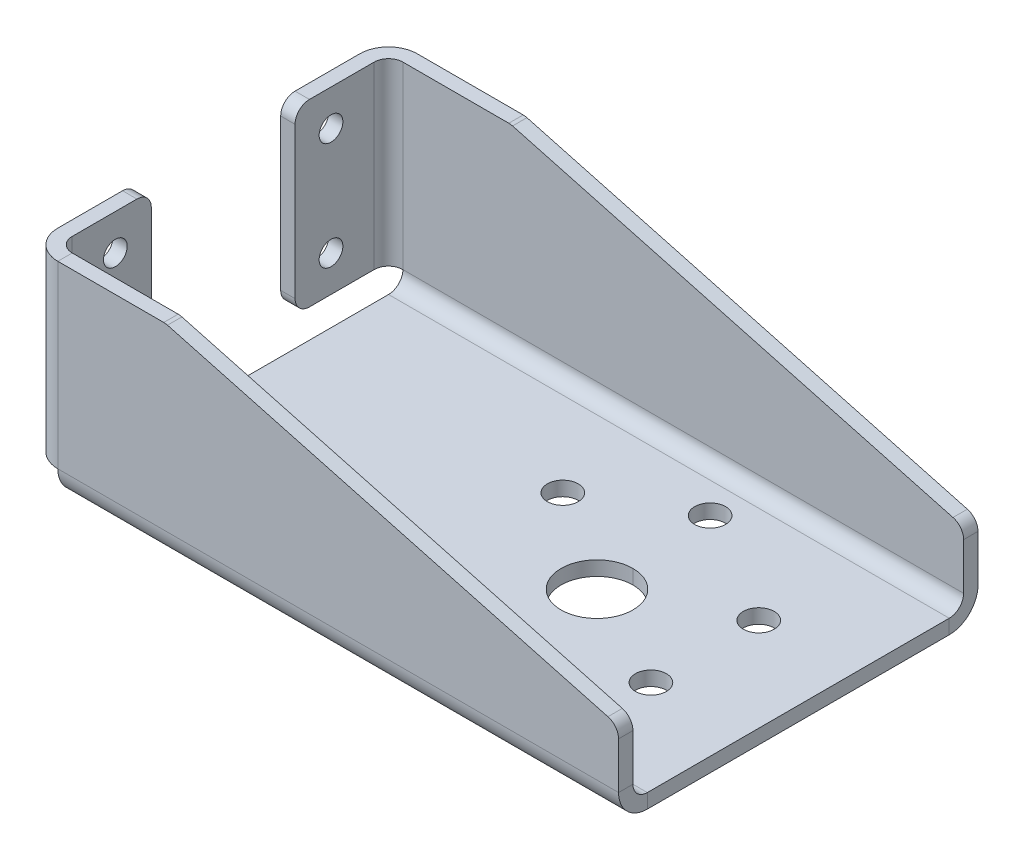
from build123d import *

# Parameters (mm, degrees)
EXTRUDE_1_DEPTH          = 78
EXTRUDE_START            = -4
EXTRUDE_1_2_OUTLINE_R    = 2.1
EXTRUDE_1_2_DEPTH        = 4
EXTRUDE_START_2          = -1
EXTRUDE_1_3_OUTLINE_R    = 5
EXTRUDE_1_3_OUTLINE_R_2  = 2.5
EXTRUDE_1_3_DEPTH        = 30
EXTRUDE_START_3          = -25
EXTRUDE_1_4_DEPTH        = 2
EXTRUDE_2_DEPTH          = 2
CUT_EXTRUDE_1_DEPTH      = 98.082439195
FILLET_1_R               = 2
EXTRUDE_START_4          = -2
SKETCH_4_R               = 2.1
SKETCH_4_R_2             = 1
EXTRUDE_3_DEPTH          = 2
HOLE_WIZARD_M4_1_D       = 3.3
HOLE_WIZARD_M4_1_DEPTH   = 11.5
HOLE_WIZARD_M4_1_TIP     = 0.991420021
SKETCH_8_W               = 20
SKETCH_8_H               = 25
CUT_EXTRUDE_2_DEPTH      = 91.498618774
FILLET_2_R               = 2
SKETCH_9_R               = 2.5
SKETCH_9_R_2             = 2.15
EXTRUDE_4_DEPTH          = 2
PATTERN_CIRCULAR_2_COUNT = 3


with BuildPart() as part:
    # ﾎﾞｽ - 押し出し1: read off the stored shape, not the designer's step
    # ﾎﾞｽ - 押し出し1 outline → ﾎﾞｽ - 押し出し1 (new body)
    with BuildSketch(Plane.YZ):
        with BuildLine():
            Line((29, 25), (4, 25))
            ThreePointArc((4, 25), (1.171572875, 23.828427125), (0, 21))
            Line((0, 21), (0, -21))
            ThreePointArc((0, -21), (1.171572875, -23.828427125), (4, -25))
            Line((4, -25), (29, -25))
            Line((29, -25), (29, -23))
            Line((29, -23), (4, -23))
            ThreePointArc((4, -23), (2.585786438, -22.414213562), (2, -21))
            Line((2, -21), (2, 21))
            ThreePointArc((2, 21), (2.585786438, 22.414213562), (4, 23))
            Line((4, 23), (29, 23))
            Line((29, 23), (29, 25))
        make_face()
    extrude(amount=EXTRUDE_1_DEPTH)

    # Extrude 1 2 outline → Extrude 1 2 (add)
    # profile 1 of 2: a face of its own
    with BuildSketch(Plane.YZ.offset(EXTRUDE_START)):
        with BuildLine():
            ThreePointArc((4, 8), (4.228361402, 6.851949703), (4.878679656, 5.878679656))
            ThreePointArc((4.878679656, 5.878679656), (5.851949703, 5.228361402), (7, 5))
            Line((7, 5), (26, 5))
            ThreePointArc((26, 5), (27.148050297, 5.228361402), (28.121320344, 5.878679656))
            ThreePointArc((28.121320344, 5.878679656), (28.771638598, 6.851949703), (29, 8))
            Line((29, 8), (29, 25))
            Line((29, 25), (4, 25))
            Line((4, 25), (4, 8))
        make_face()
        with Locations((9, 15)):
            Circle(EXTRUDE_1_2_OUTLINE_R, mode=Mode.SUBTRACT)
        with Locations((24, 15)):
            Circle(EXTRUDE_1_2_OUTLINE_R, mode=Mode.SUBTRACT)
    # profile 2 of 2: a face of its own
    with BuildSketch(Plane.YZ.offset(EXTRUDE_START)):
        with BuildLine():
            Line((4, -25), (29, -25))
            Line((29, -25), (29, -8))
            ThreePointArc((29, -8), (28.771638598, -6.851949703), (28.121320344, -5.878679656))
            ThreePointArc((28.121320344, -5.878679656), (27.148050297, -5.228361402), (26, -5))
            Line((26, -5), (7, -5))
            ThreePointArc((7, -5), (5.851949703, -5.228361402), (4.878679656, -5.878679656))
            ThreePointArc((4.878679656, -5.878679656), (4.228361402, -6.851949703), (4, -8))
            Line((4, -8), (4, -25))
        make_face()
        with Locations((9, -15)):
            Circle(EXTRUDE_1_2_OUTLINE_R, mode=Mode.SUBTRACT)
        with Locations((24, -15)):
            Circle(EXTRUDE_1_2_OUTLINE_R, mode=Mode.SUBTRACT)
    extrude(amount=EXTRUDE_1_2_DEPTH)

    # Extrude 1 3 outline → Extrude 1 3 (cut)
    with BuildSketch(Plane(origin=(0, 0, 0), x_dir=(1, 0, 0), z_dir=(0, 1, 0)).offset(EXTRUDE_START_2)):
        with Locations((50, 0)):
            Circle(EXTRUDE_1_3_OUTLINE_R)
        with BuildLine():
            Line((0, -5), (-2, -5))
            Line((-2, -5), (-2, -21))
            ThreePointArc((-2, -21), (-1.414213562, -22.414213562), (0, -23))
            Line((0, -23), (0, -5))
        make_face()
        with BuildLine():
            ThreePointArc((0, -25), (-2.828427125, -23.828427125), (-4, -21))
            Line((-4, -21), (-4, -25))
            Line((-4, -25), (0, -25))
        make_face()
        with BuildLine():
            Line((0, 5), (0, 23))
            ThreePointArc((0, 23), (-1.414213562, 22.414213562), (-2, 21))
            Line((-2, 21), (-2, 5))
            Line((-2, 5), (0, 5))
        make_face()
        with BuildLine():
            ThreePointArc((-4, 21), (-2.828427125, 23.828427125), (0, 25))
            Line((0, 25), (-4, 25))
            Line((-4, 25), (-4, 21))
        make_face()
        with Locations((36.004809472, 9.240381057)):
            Circle(EXTRUDE_1_3_OUTLINE_R_2)
        with Locations((48.995190528, -16.740381057)):
            Circle(EXTRUDE_1_3_OUTLINE_R_2)
        with Locations((65, -7.5)):
            Circle(EXTRUDE_1_3_OUTLINE_R_2)
        with Locations((65, 7.5)):
            Circle(EXTRUDE_1_3_OUTLINE_R_2)
        with Locations((36.004809472, -9.240381057)):
            Circle(EXTRUDE_1_3_OUTLINE_R_2)
        with Locations((48.995190528, 16.740381057)):
            Circle(EXTRUDE_1_3_OUTLINE_R_2)
    extrude(amount=EXTRUDE_1_3_DEPTH, mode=Mode.SUBTRACT)

    # Extrude 1 4 outline → Extrude 1 4 (cut)
    with BuildSketch(Plane.XY.offset(EXTRUDE_START_3)):
        with BuildLine():
            ThreePointArc((76.562947136, 7.421535507), (77.140312684, 7.145469965), (77.600920715, 6.701168941))
            ThreePointArc((77.600920715, 6.701168941), (77.89760921, 6.134124767), (78, 5.502397544))
            Line((78, 5.502397544), (78, 29))
            Line((78, 29), (2.712718898, 29))
            ThreePointArc((2.712718898, 29), (2.855262652, 28.994913852), (2.997081408, 28.979681278))
            ThreePointArc((2.997081408, 28.979681278), (3.137453853, 28.954379753), (3.275666034, 28.919137963))
            Line((3.275666034, 28.919137963), (76.562947136, 7.421535507))
        make_face()
    extrude(amount=EXTRUDE_1_4_DEPTH, mode=Mode.SUBTRACT)

    # ｽｹｯﾁ2 → ﾎﾞｽ - 押し出し2 (add)
    with BuildSketch(Plane(origin=(0, 0, -25), x_dir=(-1, 0, 0), z_dir=(0, 0, -1))):
        with BuildLine():
            ThreePointArc((-2.997081408, 28.979681278), (-2.855262652, 28.994913852), (-2.712718898, 29))
            Line((-2.712718898, 29), (-78, 29))
            Line((-78, 29), (-78, 5.502397544))
            ThreePointArc((-78, 5.502397544), (-77.89760921, 6.134124767), (-77.600920715, 6.701168941))
            ThreePointArc((-77.600920715, 6.701168941), (-77.140312684, 7.145469965), (-76.562947136, 7.421535507))
            Line((-76.562947136, 7.421535507), (-3.275666034, 28.919137963))
            ThreePointArc((-3.275666034, 28.919137963), (-3.137453853, 28.954379753), (-2.997081408, 28.979681278))
        make_face()
    extrude(amount=-EXTRUDE_2_DEPTH)

    # ｽｹｯﾁ3 → ｶｯﾄ - 押し出し1 (cut, through all)
    with BuildSketch(Plane.XY.offset(25)):
        Polygon((78, 29), (15, 29), (78, 12), align=None)
    extrude(amount=-CUT_EXTRUDE_1_DEPTH, mode=Mode.SUBTRACT)

    # ﾌｨﾚｯﾄ1
    fillet_1_edges = [part.edges().sort_by_distance(p)[0] for p in [
        (15, 29, -24),
        (78, 12, -24),
        (15, 29, 24),
        (78, 12, 24),
    ]]
    fillet(fillet_1_edges, radius=FILLET_1_R)

    # ｽｹｯﾁ4 → ﾎﾞｽ - 押し出し3 (add)
    # profile 1 of 2: a face of its own
    with BuildSketch(Plane(origin=(-2, 0, 0), x_dir=(0, 0, -1), z_dir=(1, 0, 0)).offset(EXTRUDE_START_4)):
        with Locations((-15, 9)):
            Circle(SKETCH_4_R)
        with Locations(Location((-15, 9, 0), (0, 0, 90))):
            Circle(SKETCH_4_R_2, mode=Mode.SUBTRACT)
    # profile 2 of 2: a face of its own
    with BuildSketch(Plane(origin=(-2, 0, 0), x_dir=(0, 0, -1), z_dir=(1, 0, 0)).offset(EXTRUDE_START_4)):
        with Locations((-15, 24)):
            Circle(SKETCH_4_R)
        with Locations(Location((-15, 24, 0), (0, 0, 90))):
            Circle(SKETCH_4_R_2, mode=Mode.SUBTRACT)
    extrude_3 = extrude(amount=EXTRUDE_3_DEPTH)

    # ﾐﾗｰ2: ﾎﾞｽ - 押し出し3 across plane
    add(extrude_3.mirror(Plane.XY))

    # M4 ねじ穴1
    with Locations(Plane.ZY.offset(4)):
        with Locations((-15, 9), (-15, 24), (15, 24), (15, 9)):
            Hole(HOLE_WIZARD_M4_1_D / 2, depth=HOLE_WIZARD_M4_1_DEPTH)
            with Locations((0, 0, -(HOLE_WIZARD_M4_1_DEPTH + HOLE_WIZARD_M4_1_TIP / 2))):  # 118° drill point
                Cone(0, HOLE_WIZARD_M4_1_D / 2, HOLE_WIZARD_M4_1_TIP, mode=Mode.SUBTRACT)

    # ｽｹｯﾁ8 → ｶｯﾄ - 押し出し2 (cut, through all)
    with BuildSketch(Plane.ZY.offset(4)):
        with Locations((0, 16.5)):
            Rectangle(SKETCH_8_W, SKETCH_8_H)
    extrude(amount=-CUT_EXTRUDE_2_DEPTH, mode=Mode.SUBTRACT)

    # ﾌｨﾚｯﾄ2
    fillet_2_edges = [part.edges().sort_by_distance(p)[0] for p in [
        (-3, 29, 10),
        (-3, 4, 10),
        (-3, 4, -10),
        (-3, 29, -10),
    ]]
    fillet(fillet_2_edges, radius=FILLET_2_R)

    # ｽｹｯﾁ9 → ﾎﾞｽ - 押し出し4 (add)
    # profile 1 of 2: a face of its own
    with BuildSketch(Plane(origin=(0, 2, 0), x_dir=(1, 0, 0), z_dir=(0, 1, 0)).offset(EXTRUDE_START_4)):
        with Locations((48.995190528, 16.740381057)):
            Circle(SKETCH_9_R)
        with Locations(Location((48.995190528, 16.740381057, 0), (0, 0, 270))):
            Circle(SKETCH_9_R_2, mode=Mode.SUBTRACT)
    # profile 2 of 2: a face of its own
    with BuildSketch(Plane(origin=(0, 2, 0), x_dir=(1, 0, 0), z_dir=(0, 1, 0)).offset(EXTRUDE_START_4)):
        with Locations((36.004809472, 9.240381057)):
            Circle(SKETCH_9_R)
        with Locations(Location((36.004809472, 9.240381057, 0), (0, 0, 270))):
            Circle(SKETCH_9_R_2, mode=Mode.SUBTRACT)
    extrude_4 = extrude(amount=EXTRUDE_4_DEPTH)

    # 円形ﾊﾟﾀｰﾝ2: ﾎﾞｽ - 押し出し4 ×3 about axis
    pattern_circular_2_axis = Axis((50, 0, 0), (0, 1, 0))
    for i in range(1, PATTERN_CIRCULAR_2_COUNT):
        add(extrude_4.rotate(pattern_circular_2_axis, i * 360 / PATTERN_CIRCULAR_2_COUNT))


solid = part.part
